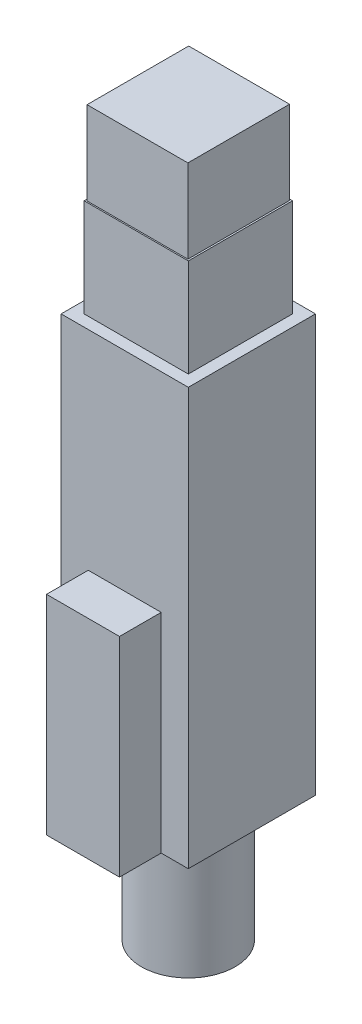
from build123d import *

# Parameters (mm, degrees)
SKETCH1_R           = 2.25
BOSS_EXTRUDE1_DEPTH = 6
SKETCH2_W           = 6.1
SKETCH2_H           = 6.1
BOSS_EXTRUDE2_DEPTH = 20
SKETCH3_W           = 5
SKETCH3_H           = 5
BOSS_EXTRUDE3_DEPTH = 8.7
SKETCH4_OUTSIDE_W   = 15.252
SKETCH4_OUTSIDE_H   = 15.252
SKETCH4_OUTSIDE_W_2 = 4.836378696
SKETCH4_OUTSIDE_H_2 = 4.876198926
CUT_EXTRUDE1_DEPTH  = 4
SKETCH5_W           = 3.5
SKETCH5_H           = 10
BOSS_EXTRUDE4_DEPTH = 2


with BuildPart() as part:
    # Sketch1 → Boss-Extrude1 (new body)
    with BuildSketch(Plane(origin=(0, 0, 0), x_dir=(1, 0, 0), z_dir=(0, 1, 0))):
        Circle(SKETCH1_R)
    extrude(amount=BOSS_EXTRUDE1_DEPTH)

    # Sketch2 → Boss-Extrude2 (add)
    with BuildSketch(Plane(origin=(0, 6, 0), x_dir=(1, 0, 0), z_dir=(0, 1, 0))):
        Rectangle(SKETCH2_W, SKETCH2_H)
    extrude(amount=BOSS_EXTRUDE2_DEPTH)

    # Sketch3 → Boss-Extrude3 (add)
    with BuildSketch(Plane(origin=(0, 26, 0), x_dir=(1, 0, 0), z_dir=(0, 1, 0))):
        Rectangle(SKETCH3_W, SKETCH3_H)
    extrude(amount=BOSS_EXTRUDE3_DEPTH)

    # Sketch4 outside → Cut-Extrude1 (cut)
    with BuildSketch(Plane(origin=(0, 34.7, 0), x_dir=(1, 0, 0), z_dir=(0, 1, 0))):
        Rectangle(SKETCH4_OUTSIDE_W, SKETCH4_OUTSIDE_H)
        Rectangle(SKETCH4_OUTSIDE_W_2, SKETCH4_OUTSIDE_H_2, mode=Mode.SUBTRACT)
    extrude(amount=-CUT_EXTRUDE1_DEPTH, mode=Mode.SUBTRACT)

    # Sketch5 → Boss-Extrude4 (add)
    with BuildSketch(Plane.XY.offset(3.05)):
        with Locations((0, 11)):
            Rectangle(SKETCH5_W, SKETCH5_H)
    extrude(amount=BOSS_EXTRUDE4_DEPTH)


solid = part.part
